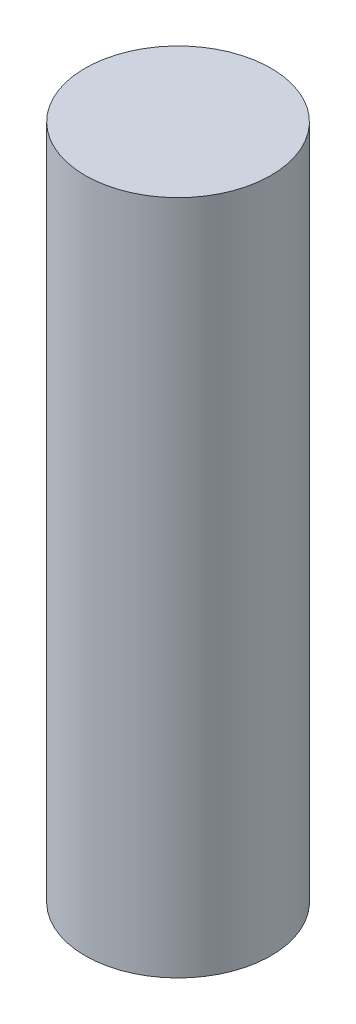
from build123d import *

# Parameters (mm, degrees)
EXTRUDE_1_DEPTH      = 10
EXTRUDE_1_DEPTH_BACK = 10
SKETCH_1_R           = 2.75


with BuildPart() as part:
    # Эскиз1 → Бобышка-Вытянуть1 (new, two sides: drawn at the far end of the back side and taken through both)
    with BuildSketch(Plane(origin=(0, 0, 0), x_dir=(1, 0, 0), z_dir=(0, 1, 0)).offset(-EXTRUDE_1_DEPTH_BACK)):
        Circle(SKETCH_1_R)
    extrude(amount=EXTRUDE_1_DEPTH + EXTRUDE_1_DEPTH_BACK)


solid = part.part
